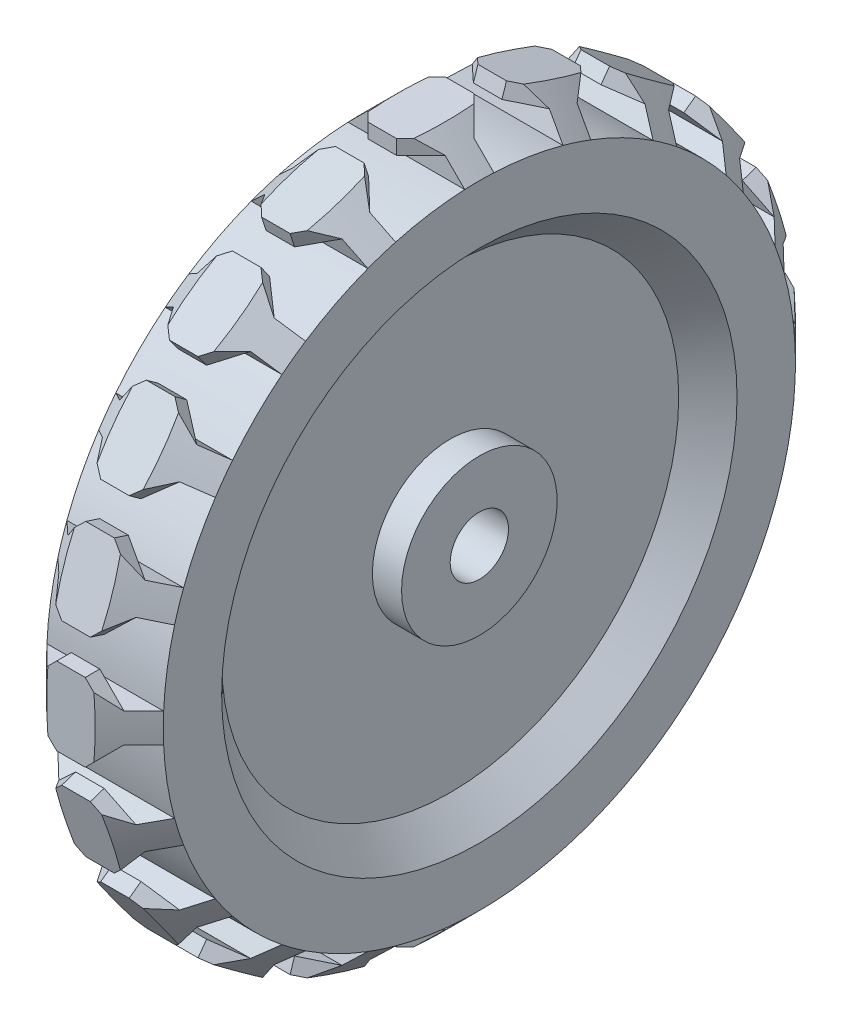
from build123d import *

# Parameters (mm, degrees)
BOSS_EXTRUDE1_DEPTH = 6
CUT_EXTRUDE1_DEPTH  = 1.5
CIRPATTERN1_COUNT   = 20
CHAMFER1_SIZE       = 3


with BuildPart() as part:
    # Sketch2 → Revolve1 (revolve)
    with BuildSketch(Plane.XY, mode=Mode.PRIVATE) as revolve1_sk:
        Polygon((6, 3), (6, 8), (3, 8), (3, 26.5), (6, 26.5), (6, 32.5), (0, 32.5), (0, 3), align=None)
    revolve(revolve1_sk.sketch.rotate(Axis((-0.3, 0, 0), (1, 0, 0)), 90), axis=Axis((-0.3, 0, 0), (1, 0, 0)))


with BuildPart() as body_2:
    # Sketch3 → Boss-Extrude1 (new body)
    with BuildSketch(Plane.ZY):
        with BuildLine():
            Line((-1.5, 32.465366161), (-1.5, 34.5))
            Line((-1.5, 34.5), (-4, 34.5))
            Line((-4, 34.5), (-4, 36))
            Line((-4, 36), (4, 36))
            Line((4, 36), (4, 34.5))
            Line((4, 34.5), (1.5, 34.5))
            Line((1.5, 34.5), (1.5, 32.465366161))
            ThreePointArc((1.5, 32.465366161), (0, 32.5), (-1.5, 32.465366161))
        make_face()
    extrude(amount=-BOSS_EXTRUDE1_DEPTH)

    # Sketch4 → Cut-Revolve1 (revolve, cut)
    with BuildSketch(Plane.XY):
        Polygon((6, 32.5), (1, 37.5), (6, 37.5), align=None)
    revolve(axis=Axis((-0.3, 0, 0), (1, 0, 0)), mode=Mode.SUBTRACT)

    # Sketch5 → Cut-Extrude1 (cut)
    with BuildSketch(Plane(origin=(0, 36, 0), x_dir=(1, 0, 0), z_dir=(0, 1, 0))):
        Polygon((3.9674067, 1.5), (1.4674067, 4), (3.9674067, 4), align=None)
    cut_extrude1 = extrude(amount=-CUT_EXTRUDE1_DEPTH, mode=Mode.SUBTRACT)

    # Mirror1: Cut-Extrude1 across plane
    add(cut_extrude1.mirror(Plane.XY), mode=Mode.SUBTRACT)


with BuildPart() as cirpattern1_1:
    # CirPattern1: pattern copy
    add(body_2.part.rotate(Axis((0, 0, 0), (1, 0, 0)), 1 * 360 / CIRPATTERN1_COUNT))


with BuildPart() as cirpattern1_2:
    # CirPattern1: pattern copy
    add(body_2.part.rotate(Axis((0, 0, 0), (1, 0, 0)), 2 * 360 / CIRPATTERN1_COUNT))


with BuildPart() as cirpattern1_3:
    # CirPattern1: pattern copy
    add(body_2.part.rotate(Axis((0, 0, 0), (1, 0, 0)), 3 * 360 / CIRPATTERN1_COUNT))


with BuildPart() as cirpattern1_4:
    # CirPattern1: pattern copy
    add(body_2.part.rotate(Axis((0, 0, 0), (1, 0, 0)), 4 * 360 / CIRPATTERN1_COUNT))


with BuildPart() as cirpattern1_5:
    # CirPattern1: pattern copy
    add(body_2.part.rotate(Axis((0, 0, 0), (1, 0, 0)), 5 * 360 / CIRPATTERN1_COUNT))


with BuildPart() as cirpattern1_6:
    # CirPattern1: pattern copy
    add(body_2.part.rotate(Axis((0, 0, 0), (1, 0, 0)), 6 * 360 / CIRPATTERN1_COUNT))


with BuildPart() as cirpattern1_7:
    # CirPattern1: pattern copy
    add(body_2.part.rotate(Axis((0, 0, 0), (1, 0, 0)), 7 * 360 / CIRPATTERN1_COUNT))


with BuildPart() as cirpattern1_8:
    # CirPattern1: pattern copy
    add(body_2.part.rotate(Axis((0, 0, 0), (1, 0, 0)), 8 * 360 / CIRPATTERN1_COUNT))


with BuildPart() as cirpattern1_9:
    # CirPattern1: pattern copy
    add(body_2.part.rotate(Axis((0, 0, 0), (1, 0, 0)), 9 * 360 / CIRPATTERN1_COUNT))


with BuildPart() as cirpattern1_10:
    # CirPattern1: pattern copy
    add(body_2.part.rotate(Axis((0, 0, 0), (1, 0, 0)), 10 * 360 / CIRPATTERN1_COUNT))


with BuildPart() as cirpattern1_11:
    # CirPattern1: pattern copy
    add(body_2.part.rotate(Axis((0, 0, 0), (1, 0, 0)), 11 * 360 / CIRPATTERN1_COUNT))


with BuildPart() as cirpattern1_12:
    # CirPattern1: pattern copy
    add(body_2.part.rotate(Axis((0, 0, 0), (1, 0, 0)), 12 * 360 / CIRPATTERN1_COUNT))


with BuildPart() as cirpattern1_13:
    # CirPattern1: pattern copy
    add(body_2.part.rotate(Axis((0, 0, 0), (1, 0, 0)), 13 * 360 / CIRPATTERN1_COUNT))


with BuildPart() as cirpattern1_14:
    # CirPattern1: pattern copy
    add(body_2.part.rotate(Axis((0, 0, 0), (1, 0, 0)), 14 * 360 / CIRPATTERN1_COUNT))


with BuildPart() as cirpattern1_15:
    # CirPattern1: pattern copy
    add(body_2.part.rotate(Axis((0, 0, 0), (1, 0, 0)), 15 * 360 / CIRPATTERN1_COUNT))


with BuildPart() as cirpattern1_16:
    # CirPattern1: pattern copy
    add(body_2.part.rotate(Axis((0, 0, 0), (1, 0, 0)), 16 * 360 / CIRPATTERN1_COUNT))


with BuildPart() as cirpattern1_17:
    # CirPattern1: pattern copy
    add(body_2.part.rotate(Axis((0, 0, 0), (1, 0, 0)), 17 * 360 / CIRPATTERN1_COUNT))


with BuildPart() as cirpattern1_18:
    # CirPattern1: pattern copy
    add(body_2.part.rotate(Axis((0, 0, 0), (1, 0, 0)), 18 * 360 / CIRPATTERN1_COUNT))


with BuildPart() as cirpattern1_19:
    # CirPattern1: pattern copy
    add(body_2.part.rotate(Axis((0, 0, 0), (1, 0, 0)), 19 * 360 / CIRPATTERN1_COUNT))


with BuildPart() as part_1:
    add(part.part)

    # Intersect1: read off the stored shape, not the designer's step
    # Intersect1: union CirPattern1_19, CirPattern1_18, CirPattern1_17, CirPattern1_16, CirPattern1_15, CirPattern1_14, CirPattern1_13, CirPattern1_12, CirPattern1_11, CirPattern1_10, CirPattern1_9, CirPattern1_8, CirPattern1_7, CirPattern1_6, CirPattern1_5, CirPattern1_4, CirPattern1_3, CirPattern1_2, CirPattern1_1, body 2
    add(cirpattern1_19.part)
    add(cirpattern1_18.part)
    add(cirpattern1_17.part)
    add(cirpattern1_16.part)
    add(cirpattern1_15.part)
    add(cirpattern1_14.part)
    add(cirpattern1_13.part)
    add(cirpattern1_12.part)
    add(cirpattern1_11.part)
    add(cirpattern1_10.part)
    add(cirpattern1_9.part)
    add(cirpattern1_8.part)
    add(cirpattern1_7.part)
    add(cirpattern1_6.part)
    add(cirpattern1_5.part)
    add(cirpattern1_4.part)
    add(cirpattern1_3.part)
    add(cirpattern1_2.part)
    add(cirpattern1_1.part)
    add(body_2.part)

    # Mirror2: part across plane


with BuildPart() as part_2:
    add(part_1.part)
    add(part_1.part.mirror(Plane(origin=(0, 0, 0), x_dir=(0, 0, 1), z_dir=(1, 0, 0))))

    # Chamfer1
    chamfer1_edges = [part_2.edges().sort_by_distance(p)[0] for p in [
        (3, 0, -26.5),
    ]]
    chamfer(chamfer1_edges, length=CHAMFER1_SIZE - 0.0001)  # a hair under: the kernel refuses the full size


solid = part_2.part
